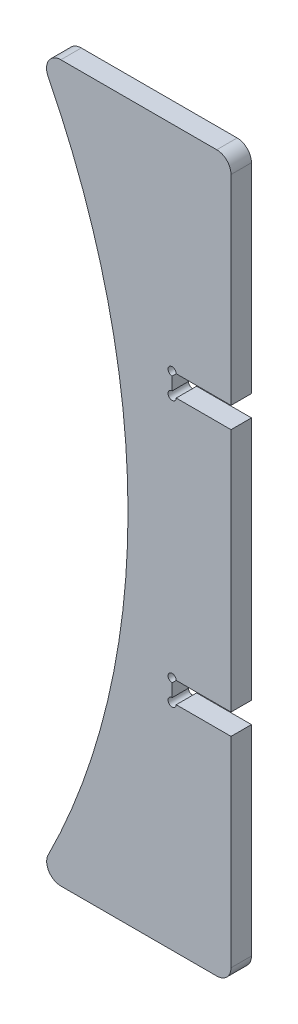
from build123d import *

# Parameters (mm, degrees)
FLANGE_BASE1_DEPTH    = 5
CORTE_EXTRUS_O1_REACH = 132.145
ESBO_O2_R             = 1


# Sheet-metal steps are written as plain solids
with BuildPart() as part:
    # Esboço1 → Flange-base1 (new body)
    with BuildSketch(Plane.XY):
        with BuildLine():
            Line((-1.722631236, 117.808229797), (-1.722631236, 68.883230259))
            Line((-1.722631236, 68.883230259), (-16.138228035, 68.883230259))
            Line((-16.138228035, 68.883230259), (-16.138228035, 63.733230259))
            Line((-16.138228035, 63.733230259), (-1.722631236, 63.733230259))
            Line((-1.722631236, 63.733230259), (-1.722631236, 3.883229335))
            Line((-1.722631236, 3.883229335), (-16.138228035, 3.883229335))
            Line((-16.138228035, 3.883229335), (-16.138228035, -1.266770665))
            Line((-16.138228035, -1.266770665), (-1.722631236, -1.266770665))
            Line((-1.722631236, -1.266770665), (-1.722631236, -50.315698913))
            ThreePointArc((-1.722631236, -50.315698913), (-2.747757502, -52.790572648), (-5.222631236, -53.815698913))
            Line((-5.222631236, -53.815698913), (-43.33867275, -53.815698913))
            ThreePointArc((-43.33867275, -53.815698913), (-46.237739354, -52.276671331), (-46.587238264, -49.01307767))
            ThreePointArc((-46.587238264, -49.01307767), (-26.931743246, 33.601550332), (-46.499490821, 116.237005793))
            ThreePointArc((-46.499490821, 116.237005793), (-46.351024737, 119.645444535), (-43.371991, 121.308229797))
            Line((-43.371991, 121.308229797), (-5.222631236, 121.308229797))
            ThreePointArc((-5.222631236, 121.308229797), (-2.747757502, 120.283103531), (-1.722631236, 117.808229797))
        make_face()
    extrude(amount=-FLANGE_BASE1_DEPTH)

    # Esboço2 → Corte-extrusão1 (cut, up to next)
    with BuildSketch(Plane.XY, mode=Mode.PRIVATE) as corte_extrus_o1_sk1:
        with Locations((-16.138228035, 68.883230259)):
            Circle(ESBO_O2_R)
    corte_extrus_o1_tool1 = extrude(corte_extrus_o1_sk1.sketch, amount=-CORTE_EXTRUS_O1_REACH, mode=Mode.PRIVATE) & part.part
    # Esboço2 → Corte-extrusão1 (cut, up to next)
    with BuildSketch(Plane.XY, mode=Mode.PRIVATE) as corte_extrus_o1_sk2:
        with Locations((-16.138228035, 63.733230259)):
            Circle(ESBO_O2_R)
    corte_extrus_o1_tool2 = extrude(corte_extrus_o1_sk2.sketch, amount=-CORTE_EXTRUS_O1_REACH, mode=Mode.PRIVATE) & part.part
    # Esboço2 → Corte-extrusão1 (cut, up to next)
    with BuildSketch(Plane.XY, mode=Mode.PRIVATE) as corte_extrus_o1_sk3:
        with Locations((-16.138228035, 3.883229335)):
            Circle(ESBO_O2_R)
    corte_extrus_o1_tool3 = extrude(corte_extrus_o1_sk3.sketch, amount=-CORTE_EXTRUS_O1_REACH, mode=Mode.PRIVATE) & part.part
    # Esboço2 → Corte-extrusão1 (cut, up to next)
    with BuildSketch(Plane.XY, mode=Mode.PRIVATE) as corte_extrus_o1_sk4:
        with Locations((-16.138228035, -1.266770665)):
            Circle(ESBO_O2_R)
    corte_extrus_o1_tool4 = extrude(corte_extrus_o1_sk4.sketch, amount=-CORTE_EXTRUS_O1_REACH, mode=Mode.PRIVATE) & part.part
    add(corte_extrus_o1_tool1.solids().sort_by_distance((-16.138228, 68.88323, 0))[0], mode=Mode.SUBTRACT)
    add(corte_extrus_o1_tool2.solids().sort_by_distance((-16.138228, 63.73323, 0))[0], mode=Mode.SUBTRACT)
    add(corte_extrus_o1_tool3.solids().sort_by_distance((-16.138228, 3.883229, 0))[0], mode=Mode.SUBTRACT)
    add(corte_extrus_o1_tool4.solids().sort_by_distance((-16.138228, -1.266771, 0))[0], mode=Mode.SUBTRACT)


solid = part.part
